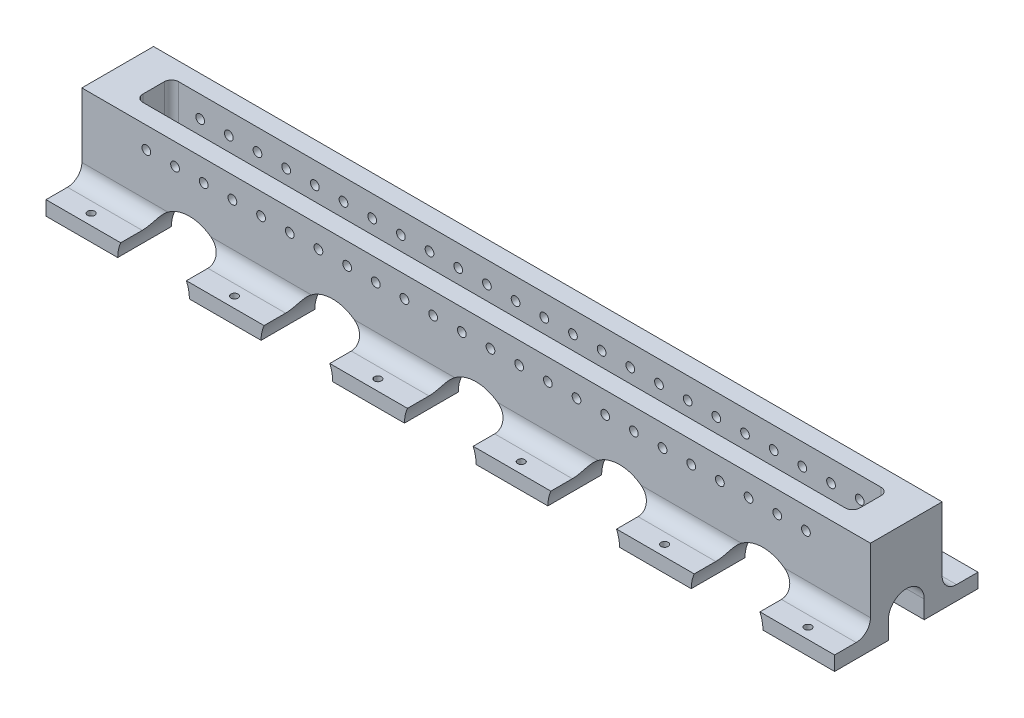
from build123d import *

# Parameters (mm, degrees)
SKETCH1_W           = 110
SKETCH1_H           = 10
SKETCH1_W_2         = 100
SKETCH1_H_2         = 5
BOSS_EXTRUDE1_DEPTH = 13
SKETCH2_W           = 5
SKETCH2_H           = 5
CUT_EXTRUDE1_DEPTH  = 111.878311675
FILLET1_R           = 2.5
SKETCH3_R           = 0.61
CUT_EXTRUDE2_DEPTH  = 58.393379409
LPATTERN1_COUNT     = 24
LPATTERN1_PITCH     = 4
SKETCH6_W           = 110
SKETCH6_H           = 5
BOSS_EXTRUDE2_DEPTH = 2
FILLET2_R           = 2
CUT_EXTRUDE4_DEPTH  = 59.472215624
LPATTERN2_COUNT     = 5
LPATTERN2_PITCH     = 20
SKETCH7_R           = 0.5
CUT_EXTRUDE5_DEPTH  = 2
LPATTERN3_COUNT     = 24
LPATTERN3_PITCH     = 20
FILLET3_R           = 1
BOSS_EXTRUDE3_DEPTH = 1
LPATTERN4_COUNT     = 4
LPATTERN4_PITCH     = 20


with BuildPart() as part:
    # Sketch1 → Boss-Extrude1 (new body)
    with BuildSketch(Plane(origin=(0, 0, 0), x_dir=(1, 0, 0), z_dir=(0, 1, 0))):
        Rectangle(SKETCH1_W, SKETCH1_H)
        Rectangle(SKETCH1_W_2, SKETCH1_H_2, mode=Mode.SUBTRACT)
    extrude(amount=BOSS_EXTRUDE1_DEPTH)

    # Sketch2 → Cut-Extrude1 (cut, through all)
    with BuildSketch(Plane(origin=(55, 0, 0), x_dir=(0, 0, -1), z_dir=(1, 0, 0))):
        with Locations((0, 2.5)):
            Rectangle(SKETCH2_W, SKETCH2_H)
    extrude(amount=-CUT_EXTRUDE1_DEPTH, mode=Mode.SUBTRACT)

    # Fillet1
    fillet1_edges = [part.edges().sort_by_distance(p)[0] for p in [
        (52.5, 5, 2.5),
        (52.5, 5, -2.5),
        (-52.5, 5, -2.5),
        (-52.5, 5, 2.5),
    ]]
    fillet(fillet1_edges, radius=FILLET1_R - 0.0001)  # a hair under: the kernel refuses the full size

    # Sketch3 → Cut-Extrude2 (cut, through all)
    with BuildSketch(Plane.XY.offset(5)):
        with Locations((-46, 10)):
            Circle(SKETCH3_R)
    cut_extrude2 = extrude(amount=-CUT_EXTRUDE2_DEPTH, mode=Mode.SUBTRACT)

    # LPattern1: Cut-Extrude2 ×24
    with Locations(*[(i * LPATTERN1_PITCH, 0, 0) for i in range(1, LPATTERN1_COUNT)]):
        add(cut_extrude2, mode=Mode.SUBTRACT)

    # Sketch6 → Boss-Extrude2 (add)
    with BuildSketch(Plane.XZ):
        with Locations((0, -7.5)):
            Rectangle(SKETCH6_W, SKETCH6_H)
        with Locations((0, 7.5)):
            Rectangle(SKETCH6_W, SKETCH6_H)
    extrude(amount=-BOSS_EXTRUDE2_DEPTH)

    # Fillet2
    fillet2_edges = [part.edges().sort_by_distance(p)[0] for p in [
        (0, 2, -5),
        (0, 2, 5),
    ]]
    fillet(fillet2_edges, radius=FILLET2_R)

    # Sketch5 → Cut-Extrude4 (cut, symmetric)
    with BuildSketch(Plane.XY.offset(5)):
        with BuildLine():
            Line((-45, 0), (-35, 0))
            ThreePointArc((-35, 0), (-40, 5), (-45, 0))
        make_face()
    cut_extrude4 = extrude(amount=CUT_EXTRUDE4_DEPTH, both=True, mode=Mode.SUBTRACT)

    # LPattern2: Cut-Extrude4 ×5
    with Locations(*[(i * LPATTERN2_PITCH, 0, 0) for i in range(1, LPATTERN2_COUNT)]):
        add(cut_extrude4, mode=Mode.SUBTRACT)

    # Sketch7 → Cut-Extrude5 (cut)
    with BuildSketch(Plane(origin=(0, 2, 0), x_dir=(1, 0, 0), z_dir=(0, 1, 0))):
        with Locations(Location((49.791287847, 8.5, 0), (0, 0, 270))):
            Circle(SKETCH7_R)
        with Locations(Location((49.791287847, -8.5, 0), (0, 0, 270))):
            Circle(SKETCH7_R)
    cut_extrude5 = extrude(amount=-CUT_EXTRUDE5_DEPTH, mode=Mode.SUBTRACT)

    # LPattern3: Cut-Extrude5 ×24
    with Locations(*[(-i * LPATTERN3_PITCH, 0, 0) for i in range(1, LPATTERN3_COUNT)]):
        add(cut_extrude5, mode=Mode.SUBTRACT)

    # Fillet3
    fillet3_edges = [part.edges().sort_by_distance(p)[0] for p in [
        (50, 7.75005, 2.5),
        (50, 7.75005, -2.5),
        (-50, 7.75005, -2.5),
        (-50, 7.75005, 2.5),
    ]]
    fillet(fillet3_edges, radius=FILLET3_R)

    # Sketch9 → Boss-Extrude3 (add, symmetric)
    with BuildSketch(Plane.ZY.offset(-30)):
        with BuildLine():
            Line((2.5, 5.5), (2.5, 3))
            ThreePointArc((2.5, 3), (1.767766953, 4.767766953), (0, 5.5))
            ThreePointArc((0, 5.5), (-1.767766953, 4.767766953), (-2.5, 3))
            Line((-2.5, 3), (-2.5, 5.5))
            Line((-2.5, 5.5), (-2.5, 6.5))
            Line((-2.5, 6.5), (0, 6.5))
            Line((0, 6.5), (2.5, 6.5))
            Line((2.5, 6.5), (2.5, 5.5))
        make_face()
    boss_extrude3 = extrude(amount=BOSS_EXTRUDE3_DEPTH, both=True)

    # LPattern4: Boss-Extrude3 ×4
    with Locations(*[(-i * LPATTERN4_PITCH, 0, 0) for i in range(1, LPATTERN4_COUNT)]):
        add(boss_extrude3)


solid = part.part
